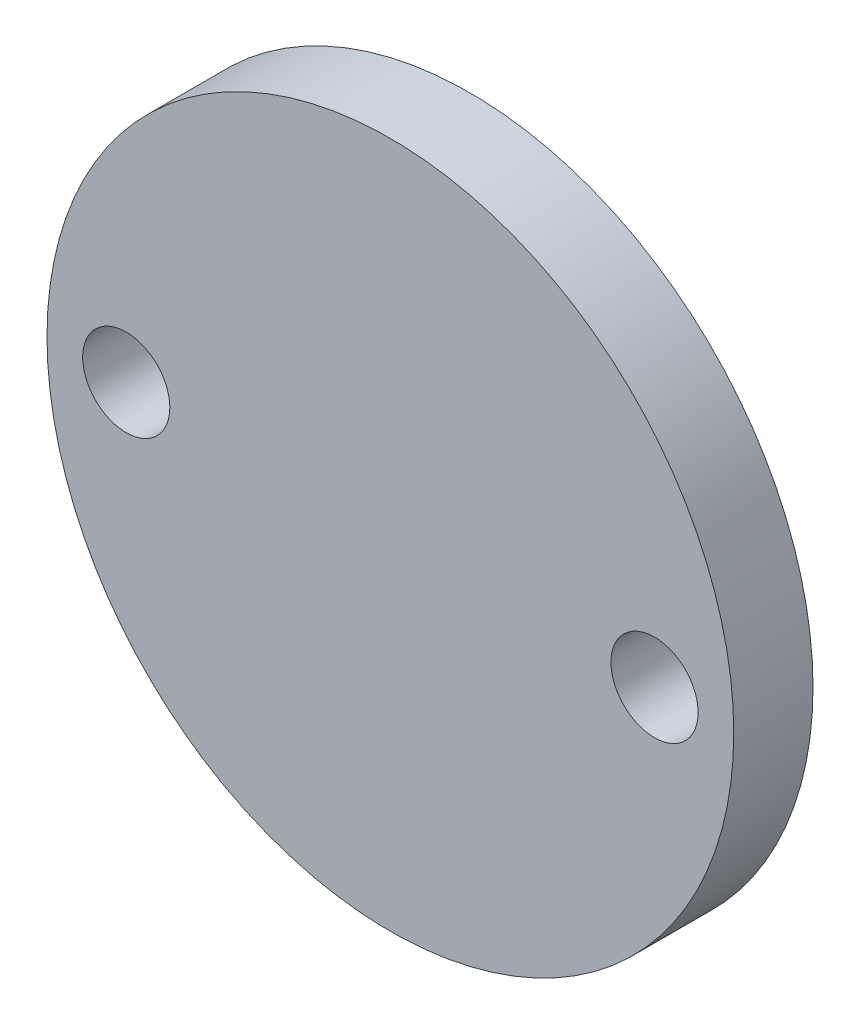
from build123d import *

# Parameters (mm, degrees)
SKETCH_1_R      = 13
SKETCH_1_R_2    = 1.65
EXTRUDE_1_DEPTH = 3


with BuildPart() as part:
    # 草图1 → 凸台-拉伸1 (new body)
    with BuildSketch(Plane.XY):
        with Locations((10, 0)):
            Circle(SKETCH_1_R)
        Circle(SKETCH_1_R_2, mode=Mode.SUBTRACT)
        with Locations((20, 0)):
            Circle(SKETCH_1_R_2, mode=Mode.SUBTRACT)
    extrude(amount=EXTRUDE_1_DEPTH)


solid = part.part
